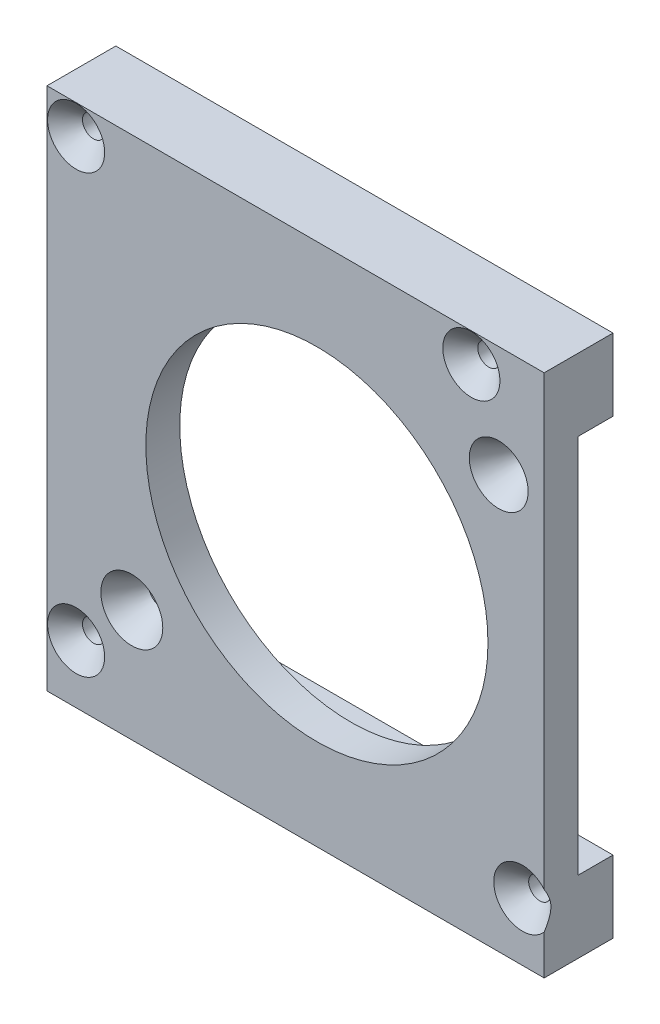
from build123d import *

# Parameters (mm, degrees)
BOSS_EXTRUDE1_DEPTH = 2.4
SKETCH2_W           = 33.15
SKETCH2_H           = 36
SKETCH2_R           = 11.75
SKETCH2_R_2         = 0.822021887
SKETCH2_R_3         = 0.927108541
BOSS_EXTRUDE2_DEPTH = 2.33
CHAMFER1_SIZE       = 1.2
CHAMFER1_SIZE2      = 2.078460969
SKETCH3_R           = 0.762
CUT_EXTRUDE1_DEPTH  = 5.8
SKETCH4_W           = 4.73
SKETCH4_H           = 36
BOSS_EXTRUDE3_DEPTH = 1
CHAMFER2_SIZE       = 1.2


with BuildPart() as part:
    # Sketch1 → Boss-Extrude1 (new body)
    with BuildSketch(Plane.XY):
        Polygon((-16.575, -18), (16.575, -18), (16.575, -13.05), (-14.975, -13.05), (-14.975, 13.05), (16.575, 13.05), (16.575, 18), (-16.575, 18), align=None)
    extrude(amount=BOSS_EXTRUDE1_DEPTH)

    # Sketch2 → Boss-Extrude2 (add)
    with BuildSketch(Plane.XY.offset(2.4)):
        Rectangle(SKETCH2_W, SKETCH2_H)
        with Locations((0.965, 0)):
            Circle(SKETCH2_R, mode=Mode.SUBTRACT)
        with Locations((13.452978113, 10.377978113)):
            Circle(SKETCH2_R_2, mode=Mode.SUBTRACT)
        with Locations((-11.747891459, -10.272891459)):
            Circle(SKETCH2_R_3, mode=Mode.SUBTRACT)
    extrude(amount=BOSS_EXTRUDE2_DEPTH)

    # Chamfer1
    chamfer1_edges = [part.edges().sort_by_distance(p)[0] for p in [
        (12.630956227, 10.377978113, 4.73),
        (-12.675, -10.272891459, 4.73),
    ]]
    chamfer1_side = [part.faces().sort_by_distance(p)[0] for p in [
        (0, 17.510620546, 4.73),
    ]]
    chamfer(chamfer1_edges, length=CHAMFER1_SIZE, length2=CHAMFER1_SIZE2, reference=chamfer1_side[0])

    # Sketch3 → Cut-Extrude1 (cut)
    with BuildSketch(Plane.XY.offset(4.73)):
        with Locations((-15.575, 16)):
            Circle(SKETCH3_R)
        with Locations(Location((11.575, 16, 0), (0, 0, 180))):
            Circle(SKETCH3_R)
        with Locations((-15.575, -14)):
            Circle(SKETCH3_R)
        with Locations(Location((15.075, -14, 0), (0, 0, 180))):
            Circle(SKETCH3_R)
    extrude(amount=-CUT_EXTRUDE1_DEPTH, mode=Mode.SUBTRACT)

    # Sketch4 → Boss-Extrude3 (add)
    with BuildSketch(Plane.ZY.offset(16.575)):
        with Locations((2.365, 0)):
            Rectangle(SKETCH4_W, SKETCH4_H)
    extrude(amount=BOSS_EXTRUDE3_DEPTH)

    # Chamfer2
    # the kernel refuses this chamfer: 1.2 mm, written as the material it takes off along each edge
    with BuildSketch(Plane(origin=(15.075, -14, 4.73), x_dir=(-1, 0, 0), z_dir=(0, 1, 0))) as chamfer2_piece_1:
        Polygon((0.762 + CHAMFER2_SIZE, 0), (0.762, -CHAMFER2_SIZE), (0.762, 0), align=None)
    revolve(axis=Axis((15.075, -14, 4.73), (0, 0, 1)), mode=Mode.SUBTRACT)
    with BuildSketch(Plane(origin=(-15.575, -14, 4.73), x_dir=(1, 0, 0), z_dir=(0, -1, 0))) as chamfer2_piece_2:
        Polygon((0.762 + CHAMFER2_SIZE, 0), (0.762, -CHAMFER2_SIZE), (0.762, 0), align=None)
    revolve(axis=Axis((-15.575, -14, 4.73), (0, 0, 1)), mode=Mode.SUBTRACT)
    with BuildSketch(Plane(origin=(11.575, 16, 4.73), x_dir=(-1, 0, 0), z_dir=(0, 1, 0))) as chamfer2_piece_3:
        Polygon((0.762 + CHAMFER2_SIZE, 0), (0.762, -CHAMFER2_SIZE), (0.762, 0), align=None)
    revolve(axis=Axis((11.575, 16, 4.73), (0, 0, 1)), mode=Mode.SUBTRACT)
    with BuildSketch(Plane(origin=(-15.575, 16, 4.73), x_dir=(1, 0, 0), z_dir=(0, -1, 0))) as chamfer2_piece_4:
        Polygon((0.762 + CHAMFER2_SIZE, 0), (0.762, -CHAMFER2_SIZE), (0.762, 0), align=None)
    revolve(axis=Axis((-15.575, 16, 4.73), (0, 0, 1)), mode=Mode.SUBTRACT)


solid = part.part
